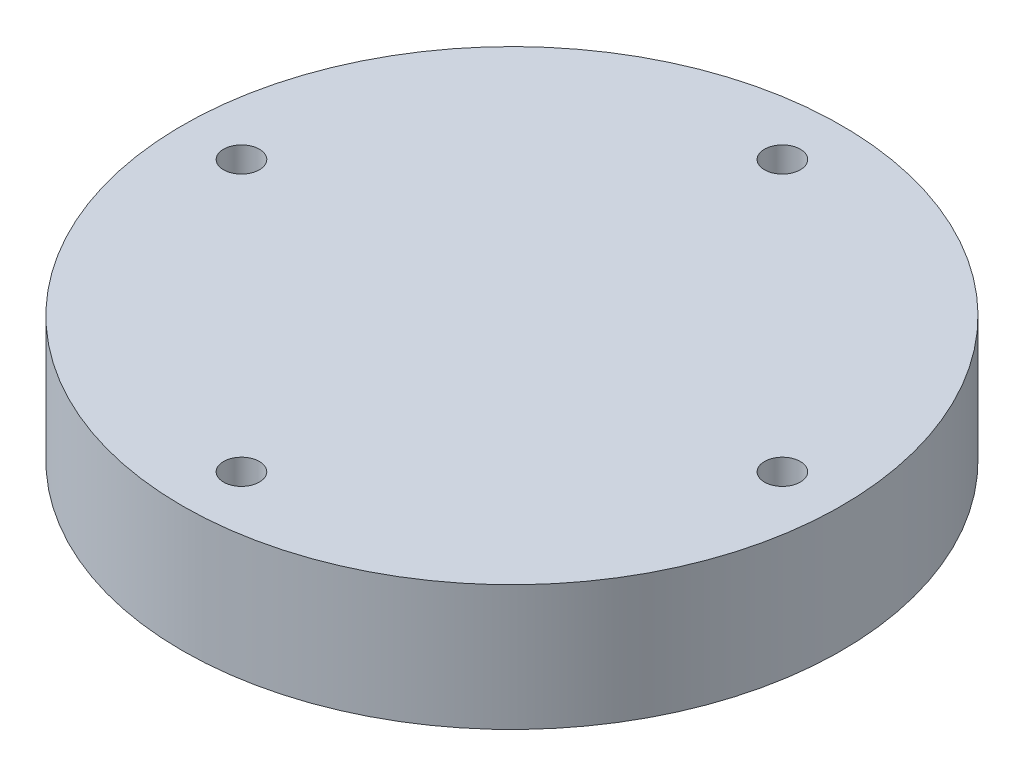
from build123d import *

# Parameters (mm, degrees)
SKETCH1_R           = 18.4
SKETCH1_R_2         = 1
BOSS_EXTRUDE1_DEPTH = 7
WRAP1_DEPTH         = 0.5


# Read off the part's stored shape, not the designer's step: Wrap1
with BuildPart() as part:
    # Sketch1 → Boss-Extrude1 (new body)
    with BuildSketch(Plane(origin=(0, 0, 0), x_dir=(1, 0, 0), z_dir=(0, 1, 0))):
        with Locations(Location((0, 0, 0), (0, 0, 270))):
            Circle(SKETCH1_R)
        with Locations(Location((0, 15.1, 0), (0, 0, 270))):
            Circle(SKETCH1_R_2, mode=Mode.SUBTRACT)
        with Locations(Location((15.1, 0, 0), (0, 0, 270))):
            Circle(SKETCH1_R_2, mode=Mode.SUBTRACT)
        with Locations(Location((0, -15.1, 0), (0, 0, 270))):
            Circle(SKETCH1_R_2, mode=Mode.SUBTRACT)
        with Locations(Location((-15.1, 0, 0), (0, 0, 270))):
            Circle(SKETCH1_R_2, mode=Mode.SUBTRACT)
    extrude(amount=BOSS_EXTRUDE1_DEPTH)

    # Wrap1 outline → Wrap1 (cut)
    # profile 1 of 12: a face of its own
    with BuildSketch(Plane(origin=(0, 0, 0), x_dir=(1, 0, 0), z_dir=(0, 1, 0))):
        with BuildLine():
            Line((-2.576923077, 7.687890169), (-3.263321314, 7.687890169))
            add(Edge.make_bspline(
                [(-3.263321314, 7.687890169), (-3.31053222, 7.687838273), (-3.400990413, 7.687738838), (-3.530705469, 7.684724092), (-3.6485152, 7.6806974), (-3.754165581, 7.675115507), (-3.847981679, 7.668518916), (-3.929538979, 7.659266877), (-3.999478535, 7.649606581), (-4.041384985, 7.639785175), (-4.060496795, 7.635306035)],
                knots=[0, 0, 0, 0, 0.176955752, 0.33905508, 0.486318225, 0.618780923, 0.735618828, 0.838742477, 0.926457068, 1, 1, 1, 1], degree=3))
            add(Edge.make_bspline(
                [(-4.060496795, 7.635306035), (-4.084690329, 7.628684085), (-4.132507306, 7.615596223), (-4.201408349, 7.5893825), (-4.266962194, 7.558300335), (-4.329393753, 7.522876395), (-4.387935836, 7.481590831), (-4.443461877, 7.436117213), (-4.495481857, 7.385405644), (-4.543703249, 7.330024904), (-4.587988047, 7.270904695), (-4.626117729, 7.207162465), (-4.658044956, 7.139871161), (-4.685428228, 7.06907759), (-4.705136682, 6.994187267), (-4.719983582, 6.915720554), (-4.72940721, 6.833685864), (-4.730309771, 6.777625997), (-4.730769231, 6.749088086)],
                knots=[0, 0, 0, 0, 0.062481339, 0.123490383, 0.183411094, 0.243153221, 0.302126735, 0.361709671, 0.421842292, 0.482931901, 0.544552254, 0.60568072, 0.667679738, 0.729984388, 0.794550921, 0.86034562, 0.928907356, 1, 1, 1, 1], degree=3))
            add(Edge.make_bspline(
                [(-4.730769231, 6.749088086), (-4.730347806, 6.720310309), (-4.72952326, 6.664004645), (-4.719626975, 6.581631857), (-4.706296783, 6.502913467), (-4.685799731, 6.428024017), (-4.658954058, 6.357408246), (-4.627462005, 6.289987014), (-4.589478475, 6.226907342), (-4.545833645, 6.167940225), (-4.49728205, 6.113030312), (-4.444029112, 6.062575518), (-4.38628982, 6.016871179), (-4.324247672, 5.975814836), (-4.257297823, 5.940358556), (-4.186455669, 5.908601251), (-4.111105453, 5.881930191), (-4.058962939, 5.867900129), (-4.032451923, 5.860766772)],
                knots=[0, 0, 0, 0, 0.070118894, 0.137192353, 0.202016181, 0.264631407, 0.326116547, 0.386010305, 0.445811847, 0.505297697, 0.564633278, 0.624282625, 0.683902032, 0.743952771, 0.805387731, 0.868388031, 0.933084028, 1, 1, 1, 1], degree=3))
            add(Edge.make_bspline(
                [(-4.032451923, 5.860766772), (-4.010524589, 5.856103791), (-3.962469562, 5.845884597), (-3.88332684, 5.83447614), (-3.791181454, 5.824738539), (-3.686159174, 5.817437402), (-3.568354269, 5.811187033), (-3.437703011, 5.806218939), (-3.293948934, 5.803489085), (-3.19367769, 5.803348293), (-3.141326122, 5.803274785)],
                knots=[0, 0, 0, 0, 0.075173117, 0.164746258, 0.268016881, 0.385911876, 0.517789479, 0.663690977, 0.824413221, 1, 1, 1, 1], degree=3))
            Line((-3.141326122, 5.803274785), (-2.891025641, 5.803274785))
            Line((-2.891025641, 5.803274785), (-2.891025641, 4.187890169))
            Line((-2.891025641, 4.187890169), (-2.576923077, 4.187890169))
            Line((-2.576923077, 4.187890169), (-2.576923077, 7.687890169))
        make_face()
        with BuildLine():
            Line((-2.891025641, 6.162249144), (-3.50380609, 6.154536804))
            add(Edge.make_bspline(
                [(-3.50380609, 6.154536804), (-3.533726016, 6.15452134), (-3.591485815, 6.154491488), (-3.674922039, 6.158476712), (-3.752331326, 6.163077244), (-3.823475901, 6.169813168), (-3.888387836, 6.179334425), (-3.947175365, 6.188946163), (-3.999382648, 6.202851526), (-4.060481849, 6.221574595), (-4.128565197, 6.253507211), (-4.202632745, 6.299857101), (-4.265403332, 6.358937809), (-4.319721629, 6.42536564), (-4.362827506, 6.49926477), (-4.394383499, 6.578333706), (-4.412924656, 6.661761556), (-4.41541085, 6.718849695), (-4.416666667, 6.747685843)],
                knots=[0, 0, 0, 0, 0.072538371, 0.140033831, 0.202495681, 0.260575056, 0.313228338, 0.361583194, 0.404878361, 0.444127437, 0.516399693, 0.586506671, 0.655085374, 0.724383783, 0.793973529, 0.861637682, 0.930110942, 1, 1, 1, 1], degree=3))
            add(Edge.make_bspline(
                [(-4.416666667, 6.747685843), (-4.41540402, 6.775824356), (-4.412894035, 6.831760238), (-4.394238172, 6.913738999), (-4.362888858, 6.991974703), (-4.319432264, 7.064947788), (-4.266691134, 7.131136592), (-4.205391791, 7.18863372), (-4.135678529, 7.234855422), (-4.070830298, 7.264688704), (-4.013229112, 7.282903979), (-3.963197152, 7.29564882), (-3.906706478, 7.305824426), (-3.843738698, 7.314063929), (-3.774781864, 7.32111739), (-3.69924355, 7.325903367), (-3.617409906, 7.328704824), (-3.560599335, 7.328843779), (-3.53114984, 7.32891581)],
                knots=[0, 0, 0, 0, 0.070043755, 0.139238317, 0.208197455, 0.279173374, 0.349986812, 0.418353846, 0.487609584, 0.557411073, 0.595330157, 0.637964052, 0.685912778, 0.738185165, 0.796102647, 0.858516544, 0.926657726, 1, 1, 1, 1], degree=3))
            Line((-3.53114984, 7.32891581), (-2.891025641, 7.32891581))
            Line((-2.891025641, 7.32891581), (-2.891025641, 6.162249144))
        make_face(mode=Mode.SUBTRACT)
    # profile 2 of 12: a face of its own
    with BuildSketch(Plane(origin=(0, 0, 0), x_dir=(1, 0, 0), z_dir=(0, 1, 0))):
        with BuildLine():
            add(Edge.make_bspline(
                [(0.003205128, 7.777633759), (-0.061602978, 7.77599228), (-0.188891445, 7.772768279), (-0.375966342, 7.748089175), (-0.554561438, 7.705393785), (-0.726131576, 7.648530803), (-0.888624553, 7.572676418), (-1.043263446, 7.480991269), (-1.189680319, 7.37251481), (-1.325901701, 7.248085584), (-1.450558651, 7.11270213), (-1.560384537, 6.96822422), (-1.652426831, 6.815525417), (-1.728012618, 6.655064587), (-1.787311228, 6.487204619), (-1.828230272, 6.311050616), (-1.854368422, 6.127743926), (-1.857424199, 6.002717061), (-1.858974359, 5.939292413)],
                knots=[0, 0, 0, 0, 0.066570035, 0.130749041, 0.1934128, 0.254989399, 0.316113556, 0.377261758, 0.439400784, 0.502970589, 0.566524976, 0.628231103, 0.689090611, 0.749344669, 0.810169593, 0.871609824, 0.934869184, 1, 1, 1, 1], degree=3))
            add(Edge.make_bspline(
                [(-1.858974359, 5.939292413), (-1.857424426, 5.876334967), (-1.85436933, 5.752238546), (-1.828200552, 5.570095102), (-1.787159552, 5.395004406), (-1.728563286, 5.227258753), (-1.653337808, 5.066681189), (-1.560682637, 4.913694235), (-1.451541426, 4.768247737), (-1.327334575, 4.631935072), (-1.191933533, 4.506937601), (-1.046703266, 4.398018725), (-0.894909946, 4.304294601), (-0.734600238, 4.229510927), (-0.567900201, 4.169739006), (-0.393317878, 4.128986376), (-0.211671324, 4.102699333), (-0.08780032, 4.099680817), (-0.024839744, 4.09814658)],
                knots=[0, 0, 0, 0, 0.065226504, 0.128568996, 0.190320378, 0.251377989, 0.312387528, 0.373788704, 0.43643116, 0.500566755, 0.564686795, 0.627135518, 0.688455409, 0.749245746, 0.810155177, 0.871670926, 0.934773496, 1, 1, 1, 1], degree=3))
            add(Edge.make_bspline(
                [(-0.024839744, 4.09814658), (0.038584575, 4.099695967), (0.163610791, 4.10275022), (0.347147827, 4.128931625), (0.523425571, 4.169872929), (0.691939922, 4.228382365), (0.852784851, 4.303999596), (1.006274934, 4.396203975), (1.151794081, 4.505611116), (1.288135828, 4.629777691), (1.412885026, 4.764949243), (1.521644402, 4.909783498), (1.613869515, 5.061438955), (1.689232847, 5.220336479), (1.748897307, 5.385707921), (1.789602125, 5.558656399), (1.815938077, 5.738195905), (1.818972924, 5.860438803), (1.820512821, 5.92246549)],
                knots=[0, 0, 0, 0, 0.065818877, 0.129746527, 0.192071954, 0.253459424, 0.314569588, 0.376279881, 0.439025654, 0.503267029, 0.567492823, 0.629704796, 0.690999649, 0.751451651, 0.812004364, 0.873149681, 0.935635484, 1, 1, 1, 1], degree=3))
            add(Edge.make_bspline(
                [(1.820512821, 5.92246549), (1.819978185, 5.964098159), (1.818915659, 6.046838283), (1.806123966, 6.169704883), (1.787562265, 6.290595541), (1.760960352, 6.409166488), (1.726168685, 6.525127473), (1.685116658, 6.639278236), (1.634976813, 6.75046196), (1.578296165, 6.859205351), (1.515034357, 6.963813257), (1.445158607, 7.06269284), (1.371123239, 7.156673837), (1.289959845, 7.243320841), (1.2043434, 7.325154497), (1.112885022, 7.400917215), (1.016142777, 7.471292165), (0.913700398, 7.534712507), (0.808082123, 7.592071641), (0.699205345, 7.641293492), (0.588548773, 7.683539554), (0.475594126, 7.717780379), (0.360641353, 7.744812415), (0.243439569, 7.763219769), (0.124082143, 7.776044086), (0.043670824, 7.777101588), (0.003205128, 7.777633759)],
                knots=[0, 0, 0, 0, 0.043208986, 0.085872872, 0.128120007, 0.170151964, 0.211917621, 0.253753003, 0.296006409, 0.338443357, 0.381015368, 0.422820479, 0.464089056, 0.505125849, 0.545974971, 0.586985211, 0.628338592, 0.670083802, 0.711991602, 0.753039155, 0.794049395, 0.834885543, 0.875498313, 0.9165473, 0.958003779, 1, 1, 1, 1], degree=3))
        make_face()
        with BuildLine():
            add(Edge.make_bspline(
                [(-0.012219551, 7.4186594), (0.020995082, 7.41825451), (0.087106815, 7.4174486), (0.185391351, 7.406832885), (0.282383285, 7.391702996), (0.378102647, 7.370121475), (0.472148937, 7.340717422), (0.565398778, 7.306876514), (0.657001832, 7.265655423), (0.74665569, 7.219082719), (0.833570765, 7.167533798), (0.915583466, 7.110562031), (0.99290611, 7.049503477), (1.065349377, 6.98421564), (1.132700549, 6.914366038), (1.196285251, 6.841013602), (1.253554832, 6.762061711), (1.306040409, 6.679651304), (1.353008249, 6.593889723), (1.394773604, 6.50567986), (1.428937613, 6.414302173), (1.456799989, 6.320748016), (1.4798998, 6.225165556), (1.494533724, 6.126829707), (1.505266084, 6.026234595), (1.506025929, 5.958252741), (1.506410256, 5.923867734)],
                knots=[0, 0, 0, 0, 0.042023329, 0.083644911, 0.124983795, 0.166247461, 0.207701556, 0.249631071, 0.29174177, 0.334742875, 0.377460169, 0.419556319, 0.461044176, 0.502096284, 0.542890714, 0.583800819, 0.624863583, 0.666224689, 0.707399186, 0.748556678, 0.789654591, 0.830739726, 0.872070142, 0.913993395, 0.95649813, 1, 1, 1, 1], degree=3))
            add(Edge.make_bspline(
                [(1.506410256, 5.923867734), (1.505135394, 5.873305513), (1.502627347, 5.773833982), (1.480669776, 5.628065839), (1.446847802, 5.487977552), (1.396990436, 5.354335643), (1.334639821, 5.22599136), (1.257612931, 5.104083255), (1.166353845, 4.988578381), (1.062690318, 4.880283112), (0.949367612, 4.781437308), (0.829034882, 4.694673899), (0.702981274, 4.621263649), (0.570878072, 4.561458577), (0.433430533, 4.514068839), (0.289752982, 4.481590208), (0.140802522, 4.460214753), (0.039271867, 4.458161997), (-0.012219551, 4.457120939)],
                knots=[0, 0, 0, 0, 0.064503999, 0.126899322, 0.18774654, 0.248149733, 0.308586065, 0.369583005, 0.431826965, 0.496179723, 0.560667855, 0.623504455, 0.685260411, 0.746536822, 0.808327352, 0.870486188, 0.934316883, 1, 1, 1, 1], degree=3))
            add(Edge.make_bspline(
                [(-0.012219551, 4.457120939), (-0.046829053, 4.457596443), (-0.115470089, 4.458539511), (-0.217565612, 4.468038188), (-0.317821823, 4.483270057), (-0.416098103, 4.505200713), (-0.512282915, 4.532647919), (-0.606777718, 4.565255647), (-0.698576008, 4.605936851), (-0.788835846, 4.650884803), (-0.875232088, 4.70212496), (-0.95770762, 4.75716311), (-1.0341836, 4.81813173), (-1.106572671, 4.882449543), (-1.17420036, 4.951413391), (-1.236609344, 5.024933613), (-1.293589476, 5.10347427), (-1.346055123, 5.185759676), (-1.392858386, 5.271755928), (-1.433637485, 5.360285606), (-1.468233601, 5.451130716), (-1.496162106, 5.544422287), (-1.518047567, 5.639983136), (-1.533127487, 5.737941214), (-1.543675926, 5.838100557), (-1.544471003, 5.905844413), (-1.544871795, 5.939993535)],
                knots=[0, 0, 0, 0, 0.043633218, 0.086537777, 0.129177336, 0.171436324, 0.213415895, 0.255265955, 0.297369481, 0.339940748, 0.382347459, 0.423952947, 0.464871163, 0.505572294, 0.546002577, 0.586567975, 0.627064799, 0.668270684, 0.709549225, 0.750428154, 0.791096194, 0.832027145, 0.873135955, 0.914610764, 0.956955986, 1, 1, 1, 1], degree=3))
            add(Edge.make_bspline(
                [(-1.544871795, 5.939993535), (-1.544470682, 5.973909039), (-1.543675, 6.041186689), (-1.533132526, 6.140647508), (-1.518031635, 6.237900719), (-1.496268927, 6.332564522), (-1.468218774, 6.424663047), (-1.433631443, 6.514109795), (-1.392846144, 6.60123799), (-1.346037919, 6.685832287), (-1.293422096, 6.767007025), (-1.235927853, 6.844609437), (-1.172562504, 6.917182179), (-1.10513648, 6.986516873), (-1.031965594, 7.051134762), (-0.9533813, 7.111057283), (-0.870337622, 7.167730557), (-0.782410387, 7.218856119), (-0.691666433, 7.266070352), (-0.598552475, 7.306521355), (-0.504123376, 7.340893474), (-0.408619263, 7.37021044), (-0.311236285, 7.39161847), (-0.212632456, 7.40684652), (-0.112944198, 7.417444905), (-0.045900978, 7.418253284), (-0.012219551, 7.4186594)],
                knots=[0, 0, 0, 0, 0.042915082, 0.085129971, 0.126473319, 0.167453038, 0.207976333, 0.248249378, 0.288749987, 0.329669857, 0.370537287, 0.411128564, 0.451818913, 0.492405877, 0.533485862, 0.575263062, 0.617440613, 0.660671688, 0.703940204, 0.746867522, 0.7890793, 0.831104042, 0.87323799, 0.91516577, 0.957380658, 1, 1, 1, 1], degree=3))
        make_face(mode=Mode.SUBTRACT)
    # profile 3 of 12: a face of its own
    with BuildSketch(Plane(origin=(0, 0, 0), x_dir=(1, 0, 0), z_dir=(0, 1, 0))):
        with BuildLine():
            ThreePointArc((-15.093956132, 0.999981736), (-14.1, 0), (-15.093956132, -0.999981736))
            ThreePointArc((-15.093956132, -0.999981736), (-14.087912264, 0), (-15.093956132, 0.999981736))
        make_face()
    # profile 4 of 12: a face of its own
    with BuildSketch(Plane(origin=(0, 0, 0), x_dir=(1, 0, 0), z_dir=(0, 1, 0))):
        with BuildLine():
            ThreePointArc((-0.999981736, -15.093956132), (0, -14.1), (0.999981736, -15.093956132))
            ThreePointArc((0.999981736, -15.093956132), (0, -14.087912264), (-0.999981736, -15.093956132))
        make_face()
    # profile 5 of 12: a face of its own
    with BuildSketch(Plane(origin=(0, 0, 0), x_dir=(1, 0, 0), z_dir=(0, 1, 0))):
        with BuildLine():
            ThreePointArc((15.093956132, -0.999981736), (14.1, 0), (15.093956132, 0.999981736))
            ThreePointArc((15.093956132, 0.999981736), (14.087912264, 0), (15.093956132, -0.999981736))
        make_face()
    # profile 6 of 12: a face of its own
    with BuildSketch(Plane(origin=(0, 0, 0), x_dir=(1, 0, 0), z_dir=(0, 1, 0))):
        with BuildLine():
            ThreePointArc((0.999981736, 15.093956132), (0, 14.1), (-0.999981736, 15.093956132))
            ThreePointArc((-0.999981736, 15.093956132), (0, 14.087912264), (0.999981736, 15.093956132))
        make_face()
    # profile 7 of 12: a face of its own
    with BuildSketch(Plane(origin=(0, 0, 0), x_dir=(1, 0, 0), z_dir=(0, 1, 0))):
        Polygon((2.942307692, 7.32891581), (2.942307692, 4.187890169), (3.256410256, 4.187890169), (3.256410256, 7.32891581), (4.019230769, 7.32891581), (4.019230769, 7.687890169), (2.179487179, 7.687890169), (2.179487179, 7.32891581), align=None)
    # profile 8 of 12: a face of its own
    with BuildSketch(Plane(origin=(0, 0, 0), x_dir=(1, 0, 0), z_dir=(0, 1, 0))):
        Polygon((0, 18.318298359), (-1, 16.586247551), (1, 16.586247551), align=None)
    # profile 9 of 12: a face of its own
    with BuildSketch(Plane(origin=(0, 0, 0), x_dir=(1, 0, 0), z_dir=(0, 1, 0))):
        Polygon((-12.309401077, 0), (-8.845299462, -2), (-8.845299462, 2), align=None)
    # profile 10 of 12: a face of its own
    with BuildSketch(Plane(origin=(0, 0, 0), x_dir=(1, 0, 0), z_dir=(0, 1, 0))):
        Polygon((0, -12.309401077), (2, -8.845299462), (-2, -8.845299462), align=None)
    # profile 11 of 12: a face of its own
    with BuildSketch(Plane(origin=(0, 0, 0), x_dir=(1, 0, 0), z_dir=(0, 1, 0))):
        Polygon((12.309401077, 0), (8.845299462, 2), (8.845299462, -2), align=None)
    # profile 12 of 12: a face of its own
    with BuildSketch(Plane(origin=(0, 0, 0), x_dir=(1, 0, 0), z_dir=(0, 1, 0))):
        Polygon((0, 12.309401077), (-2, 8.845299462), (2, 8.845299462), align=None)
    extrude(amount=WRAP1_DEPTH, mode=Mode.SUBTRACT)


solid = part.part
